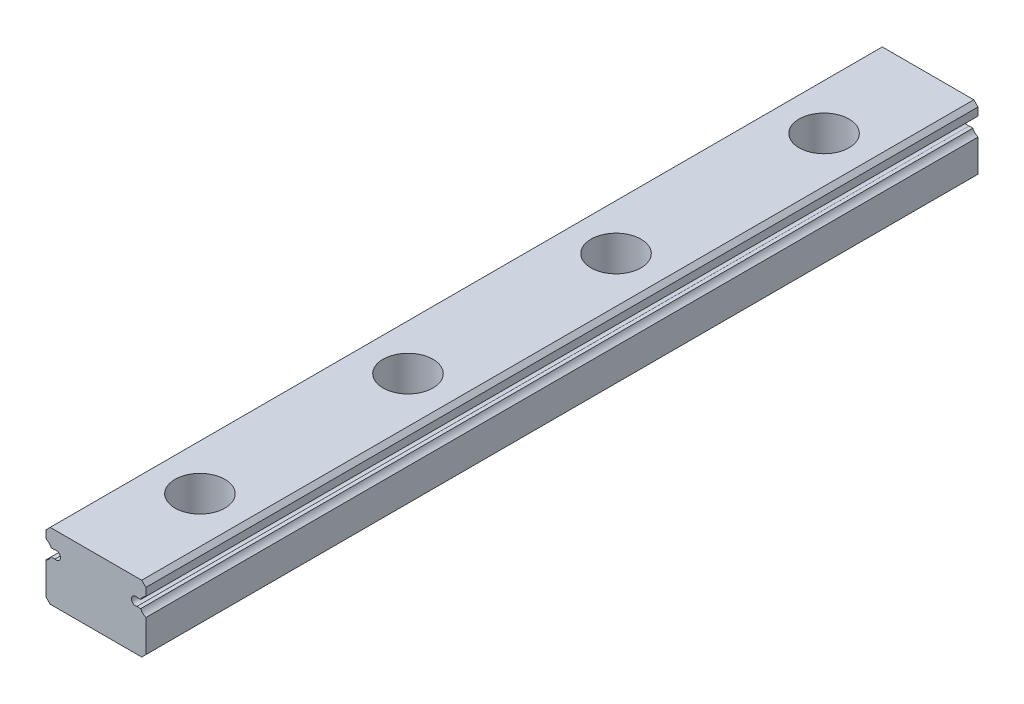
from build123d import *

# Parameters (mm, degrees)
BOSS_EXTRUDE1_DEPTH = 100
SKETCH2_R           = 3
CUT_EXTRUDE1_DEPTH  = 4.5
SKETCH3_R           = 1.75
CUT_EXTRUDE2_DEPTH  = 101.280855601
LPATTERN1_COUNT     = 4
LPATTERN1_PITCH     = 25


with BuildPart() as part:
    # Sketch1 → Boss-Extrude1 (new body)
    with BuildSketch(Plane.XY):
        with BuildLine():
            Line((-5.5, -4), (5.5, -4))
            Line((5.5, -4), (6, -3.5))
            Line((6, -3.5), (6, 0.368911094))
            ThreePointArc((6, 0.368911094), (5.63354293, 0.61854293), (5.383911094, 0.985))
            Line((5.383911094, 0.985), (4.92112495, 0.985))
            ThreePointArc((4.92112495, 0.985), (4.265, 1.46), (4.92112495, 1.935))
            Line((4.92112495, 1.935), (5.383911094, 1.935))
            ThreePointArc((5.383911094, 1.935), (5.63354293, 2.30145707), (6, 2.551088906))
            Line((6, 2.551088906), (6, 3.5))
            Line((6, 3.5), (5.5, 4))
            Line((5.5, 4), (-5.5, 4))
            Line((-5.5, 4), (-6, 3.5))
            Line((-6, 3.5), (-6, 2.551088906))
            ThreePointArc((-6, 2.551088906), (-5.63354293, 2.30145707), (-5.383911094, 1.935))
            Line((-5.383911094, 1.935), (-4.92112495, 1.935))
            ThreePointArc((-4.92112495, 1.935), (-4.265, 1.46), (-4.92112495, 0.985))
            Line((-4.92112495, 0.985), (-5.383911094, 0.985))
            ThreePointArc((-5.383911094, 0.985), (-5.63354293, 0.61854293), (-6, 0.368911094))
            Line((-6, 0.368911094), (-6, -3.5))
            Line((-6, -3.5), (-5.5, -4))
        make_face()
    extrude(amount=BOSS_EXTRUDE1_DEPTH)

    # Sketch2 → Cut-Extrude1 (cut)
    with BuildSketch(Plane(origin=(0, 4, 0), x_dir=(1, 0, 0), z_dir=(0, 1, 0))):
        with Locations((0, -12.5)):
            Circle(SKETCH2_R)
    cut_extrude1 = extrude(amount=-CUT_EXTRUDE1_DEPTH, mode=Mode.SUBTRACT)

    # Sketch3 → Cut-Extrude2 (cut, through all)
    with BuildSketch(Plane(origin=(0, -0.5, 0), x_dir=(1, 0, 0), z_dir=(0, 1, 0))):
        with Locations((0, -12.5)):
            Circle(SKETCH3_R)
    cut_extrude2 = extrude(amount=-CUT_EXTRUDE2_DEPTH, mode=Mode.SUBTRACT)

    # LPattern1: Cut-Extrude1, Cut-Extrude2 ×4
    with Locations(*[(0, 0, i * LPATTERN1_PITCH) for i in range(1, LPATTERN1_COUNT)]):
        add(cut_extrude1, mode=Mode.SUBTRACT)
        add(cut_extrude2, mode=Mode.SUBTRACT)


solid = part.part
